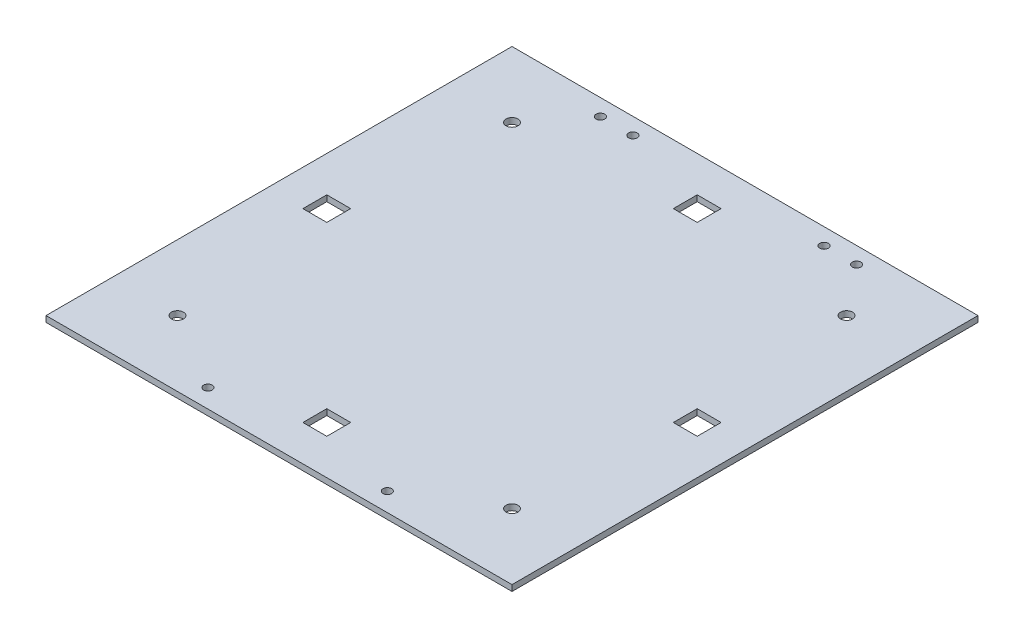
from build123d import *

# Parameters (mm, degrees)
SKETCH1_W               = 247.65
SKETCH1_H               = 247.65
MAIN_BODY_DEPTH         = 3.175
SKETCH2_R               = 2.286
HINGES_LOCK_HOLES_DEPTH = 351.244379862
SKETCH3_R               = 3.175
THREAD_HOLES_DEPTH      = 351.244379862
SKETCH4_W               = 12.7
SKETCH4_H               = 12.7
LED_HOLES_DEPTH         = 351.244379862


with BuildPart() as part:
    # Sketch1 → Main Body (new body)
    with BuildSketch(Plane(origin=(0, 0, 0), x_dir=(1, 0, 0), z_dir=(0, 1, 0))):
        with Locations((123.825, 123.825)):
            Rectangle(SKETCH1_W, SKETCH1_H)
    extrude(amount=MAIN_BODY_DEPTH)

    # Sketch2 → Hinges/Lock Holes (cut, through all)
    with BuildSketch(Plane(origin=(0, 3.175, 0), x_dir=(1, 0, 0), z_dir=(0, 1, 0))):
        with Locations((55.753, 238.8616)):
            Circle(SKETCH2_R)
        with Locations((73.025, 238.8616)):
            Circle(SKETCH2_R)
        with Locations((174.625, 238.8616)):
            Circle(SKETCH2_R)
        with Locations((191.897, 238.8616)):
            Circle(SKETCH2_R)
        with Locations((76.15682, 9.906)):
            Circle(SKETCH2_R)
        with Locations((171.49318, 9.906)):
            Circle(SKETCH2_R)
    extrude(amount=-HINGES_LOCK_HOLES_DEPTH, mode=Mode.SUBTRACT)

    # Sketch3 → Thread Holes (cut, through all)
    with BuildSketch(Plane(origin=(0, 3.175, 0), x_dir=(1, 0, 0), z_dir=(0, 1, 0))):
        with Locations((212.725, 212.725)):
            Circle(SKETCH3_R)
        with Locations((212.725, 34.925)):
            Circle(SKETCH3_R)
        with Locations((34.925, 34.925)):
            Circle(SKETCH3_R)
        with Locations((34.925, 212.725)):
            Circle(SKETCH3_R)
    extrude(amount=-THREAD_HOLES_DEPTH, mode=Mode.SUBTRACT)

    # Sketch4 → LED Holes (cut, through all)
    with BuildSketch(Plane(origin=(0, 3.175, 0), x_dir=(1, 0, 0), z_dir=(0, 1, 0))):
        with Locations((123.825, 25.4)):
            Rectangle(SKETCH4_W, SKETCH4_H)
        with Locations((25.4, 123.825)):
            Rectangle(SKETCH4_W, SKETCH4_H)
        with Locations((123.825, 222.25)):
            Rectangle(SKETCH4_W, SKETCH4_H)
        with Locations((222.25, 123.825)):
            Rectangle(SKETCH4_W, SKETCH4_H)
    extrude(amount=-LED_HOLES_DEPTH, mode=Mode.SUBTRACT)


solid = part.part
